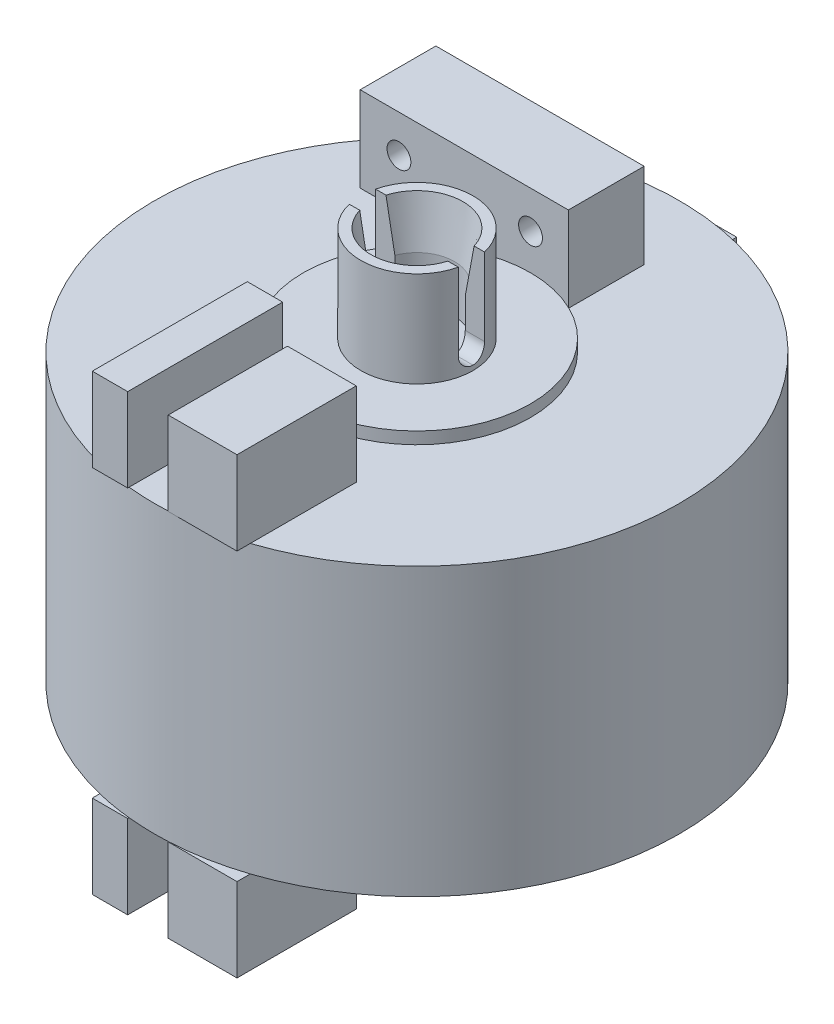
from build123d import *

# Parameters (mm, degrees)
SKETCH1_R               = 22
BOSS_EXTRUDE1_DEPTH     = 12
SKETCH2_W               = 2.968955178
SKETCH2_H               = 13
SKETCH2_W_2             = 5.766624481
SKETCH2_H_2             = 10
BOSS_EXTRUDE2_DEPTH     = 7
SKETCH3_R               = 4.7
BOSS_EXTRUDE3_DEPTH     = 9
SKETCH5_R               = 9.525
BOSS_EXTRUDE4_DEPTH     = 1
CUT_EXTRUDE1_START      = -8
SKETCH6_R               = 3.15
CUT_EXTRUDE1_DEPTH      = 54.354161882
CHAMFER1_SIZE           = 4
CHAMFER1_SIZE2          = 0.705307923
SKETCH7_W               = 2.2
SKETCH7_H               = 7.6
CUT_EXTRUDE2_DEPTH      = 38.536648758
FILLET1_R               = 1.1
SKETCH8_W               = 17.4625
SKETCH8_H               = 6.35
BOSS_EXTRUDE6_DEPTH     = 7.14375
SKETCH9_W               = 11.1125
SKETCH9_H               = 7.9375
BOSS_EXTRUDE7_DEPTH     = 23.8125
CUT_EXTRUDE3_DEPTH      = 49.574845643
CUT_EXTRUDE3_DEPTH_BACK = 6.35
SKETCH10_R              = 1
MIRROR6_OUTLINE_W       = 9.525
MIRROR6_OUTLINE_H       = 1
MIRROR6_START           = -19
MIRROR6_2_OUTLINE_W     = 2.968955178
MIRROR6_2_OUTLINE_H     = 13
MIRROR6_2_OUTLINE_W_2   = 5.766624481
MIRROR6_2_OUTLINE_H_2   = 10
MIRROR6_2_DEPTH         = 7
MIRROR6_START_2         = -20.567999245
MIRROR6_3_DEPTH         = 1.567999245
MIRROR6_START_3         = -14.5000001
MIRROR6_4_DEPTH         = 1.5000001
MIRROR6_START_4         = -6
MIRROR6_5_DEPTH         = 12


with BuildPart() as part:
    # Sketch1 → Boss-Extrude1 (new, symmetric)
    with BuildSketch(Plane(origin=(0, 0, 0), x_dir=(1, 0, 0), z_dir=(0, 1, 0))):
        with Locations(Location((0, 0, 0), (0, 0, 270))):
            Circle(SKETCH1_R)
    extrude(amount=BOSS_EXTRUDE1_DEPTH, both=True)

    # Sketch2 → Boss-Extrude2 (add)
    with BuildSketch(Plane(origin=(0, 12, 0), x_dir=(1, 0, 0), z_dir=(0, 1, 0))):
        with Locations((-3.739741619, -15.5)):
            Rectangle(SKETCH2_W, SKETCH2_H)
        with Locations((4.02804821, -17)):
            Rectangle(SKETCH2_W_2, SKETCH2_H_2)
    extrude(amount=BOSS_EXTRUDE2_DEPTH)

    # Sketch3 → Boss-Extrude3 (add)
    with BuildSketch(Plane(origin=(0, 12, 0), x_dir=(1, 0, 0), z_dir=(0, 1, 0))):
        with Locations(Location((0, 0, 0), (0, 0, 270))):
            Circle(SKETCH3_R)
    extrude(amount=BOSS_EXTRUDE3_DEPTH)

    # Sketch5 → Boss-Extrude4 (add)
    with BuildSketch(Plane(origin=(0, 12, 0), x_dir=(1, 0, 0), z_dir=(0, 1, 0))):
        Circle(SKETCH5_R)
    extrude(amount=BOSS_EXTRUDE4_DEPTH)

    # Sketch6 → Cut-Extrude1 (cut)
    with BuildSketch(Plane(origin=(0, 21, 0), x_dir=(1, 0, 0), z_dir=(0, 1, 0)).offset(CUT_EXTRUDE1_START)):
        with Locations(Location((0, 0, 0), (0, 0, 90))):
            Circle(SKETCH6_R)
    extrude(amount=CUT_EXTRUDE1_DEPTH, mode=Mode.SUBTRACT)

    # Chamfer1
    chamfer1_edges = [part.edges().sort_by_distance(p)[0] for p in [
        (0, 21, 3.15),
    ]]
    chamfer1_side = [part.faces().sort_by_distance(p)[0] for p in [
        (0, 17, 3.15),
    ]]
    chamfer(chamfer1_edges, length=CHAMFER1_SIZE, length2=CHAMFER1_SIZE2, reference=chamfer1_side[0])

    # Sketch7 → Cut-Extrude2 (cut, symmetric)
    with BuildSketch(Plane(origin=(0, 0, 0), x_dir=(0, 0, -1), z_dir=(1, 0, 0))):
        with Locations((0, 17.2)):
            Rectangle(SKETCH7_W, SKETCH7_H)
    extrude(amount=CUT_EXTRUDE2_DEPTH, both=True, mode=Mode.SUBTRACT)

    # Fillet1
    fillet1_edges = [part.edges().sort_by_distance(p)[0] for p in [
        (3.760579146, 13.4, -1.1),
        (-3.760579146, 13.4, -1.1),
        (3.760579146, 13.4, 1.1),
        (-3.760579146, 13.4, 1.1),
    ]]
    fillet(fillet1_edges, radius=FILLET1_R - 0.0001)  # a hair under: the kernel refuses the full size

    # Sketch9 → Boss-Extrude7 (add)
    with BuildSketch(Plane.XY):
        with Locations((-2.55625, 5.96875)):
            Rectangle(SKETCH9_W, SKETCH9_H)
    extrude(amount=-BOSS_EXTRUDE7_DEPTH)

    # Mirror6: read off the stored shape, not the designer's step
    # Mirror6 outline → Mirror6 (revolve)
    with BuildSketch(Plane.XY):
        with Locations((4.7625, -12.5)):
            Rectangle(MIRROR6_OUTLINE_W, MIRROR6_OUTLINE_H)
    revolve(axis=Axis((0, 0, 0), (0, 1, 0)))

    # Mirror6 2 outline → Mirror6 2 (add)
    with BuildSketch(Plane(origin=(0, 0, 0), x_dir=(1, 0, 0), z_dir=(0, 1, 0)).offset(MIRROR6_START)):
        with BuildLine():
            Line((2.951694429, 1.1), (4.569463864, 1.1))
            ThreePointArc((4.569463864, 1.1), (0, 4.7), (-4.569463864, 1.1))
            Line((-4.569463864, 1.1), (-2.951694429, 1.1))
            ThreePointArc((-2.951694429, 1.1), (0, 3.15), (2.951694429, 1.1))
        make_face()
        with BuildLine():
            ThreePointArc((-4.569463864, -1.1), (0, -4.7), (4.569463864, -1.1))
            Line((4.569463864, -1.1), (2.951694429, -1.1))
            ThreePointArc((2.951694429, -1.1), (0, -3.15), (-2.951694429, -1.1))
            Line((-2.951694429, -1.1), (-4.569463864, -1.1))
        make_face()
        with Locations((-3.739741619, -15.5)):
            Rectangle(MIRROR6_2_OUTLINE_W, MIRROR6_2_OUTLINE_H)
        with Locations((4.02804821, -17)):
            Rectangle(MIRROR6_2_OUTLINE_W_2, MIRROR6_2_OUTLINE_H_2)
    extrude(amount=MIRROR6_2_DEPTH)

    # Mirror6 3 outline → Mirror6 3 (add)
    with BuildSketch(Plane(origin=(0, 0, 0), x_dir=(1, 0, 0), z_dir=(0, 1, 0)).offset(MIRROR6_START_2)):
        with BuildLine():
            Line((2.951694429, 1.1), (4.569463864, 1.1))
            ThreePointArc((4.569463864, 1.1), (0, 4.7), (-4.569463864, 1.1))
            Line((-4.569463864, 1.1), (-2.951694429, 1.1))
            ThreePointArc((-2.951694429, 1.1), (0, 3.15), (2.951694429, 1.1))
        make_face()
        with BuildLine():
            ThreePointArc((-4.569463864, -1.1), (0, -4.7), (4.569463864, -1.1))
            Line((4.569463864, -1.1), (2.951694429, -1.1))
            ThreePointArc((2.951694429, -1.1), (0, -3.15), (-2.951694429, -1.1))
            Line((-2.951694429, -1.1), (-4.569463864, -1.1))
        make_face()
    extrude(amount=MIRROR6_3_DEPTH)

    # Mirror6 4 outline → Mirror6 4 (add)
    with BuildSketch(Plane(origin=(0, 0, 0), x_dir=(1, 0, 0), z_dir=(0, 1, 0)).offset(MIRROR6_START_3)):
        with BuildLine():
            ThreePointArc((4.569463864, -1.1), (4.7, 0), (4.569463864, 1.1))
            Line((4.569463864, 1.1), (2.951694429, 1.1))
            ThreePointArc((2.951694429, 1.1), (3.15, 0), (2.951694429, -1.1))
            Line((2.951694429, -1.1), (4.569463864, -1.1))
        make_face()
        with BuildLine():
            Line((-2.951694429, 1.1), (-4.569463864, 1.1))
            ThreePointArc((-4.569463864, 1.1), (-4.7, 0), (-4.569463864, -1.1))
            Line((-4.569463864, -1.1), (-2.951694429, -1.1))
            ThreePointArc((-2.951694429, -1.1), (-3.15, 0), (-2.951694429, 1.1))
        make_face()
    extrude(amount=MIRROR6_4_DEPTH)

    # Mirror6 5 outline → Mirror6 5 (cut)
    with BuildSketch(Plane.YZ.offset(MIRROR6_START_4)):
        with BuildLine():
            ThreePointArc((-13.4, 0), (-13.722182541, 0.777817459), (-14.5, 1.1))
            Line((-14.5, 1.1), (-14.5, -1.1))
            ThreePointArc((-14.5, -1.1), (-13.722182541, -0.777817459), (-13.4, 0))
        make_face()
    extrude(amount=MIRROR6_5_DEPTH, mode=Mode.SUBTRACT)

    # Mirror6 6 outline → Mirror6 6 (revolve, cut)
    with BuildSketch(Plane.XY):
        Polygon((4.700000002, -20.567998898), (3.14999999, -20.294692075), (3.15, -20.567999245), align=None)
    revolve(axis=Axis((0, 0, 0), (0, 1, 0)), mode=Mode.SUBTRACT)


with BuildPart() as body_2:
    # Sketch8 → Boss-Extrude6 (new body)
    with BuildSketch(Plane(origin=(0, 12, 0), x_dir=(1, 0, 0), z_dir=(0, 1, 0))):
        with Locations((-5.55625, 12.7)):
            Rectangle(SKETCH8_W, SKETCH8_H)
    extrude(amount=BOSS_EXTRUDE6_DEPTH)

    # Sketch10 → Cut-Extrude3 (cut, two sides: drawn at the far end of the back side and taken through both)
    with BuildSketch(Plane(origin=(0, 0, -15.875), x_dir=(-1, 0, 0), z_dir=(0, 0, -1)).offset(-CUT_EXTRUDE3_DEPTH_BACK)):
        with Locations((0, 16)):
            Circle(SKETCH10_R)
        with Locations((11.032684987, 16)):
            Circle(SKETCH10_R)
    extrude(amount=CUT_EXTRUDE3_DEPTH + CUT_EXTRUDE3_DEPTH_BACK, mode=Mode.SUBTRACT)


solid = Compound([part.part, body_2.part])
